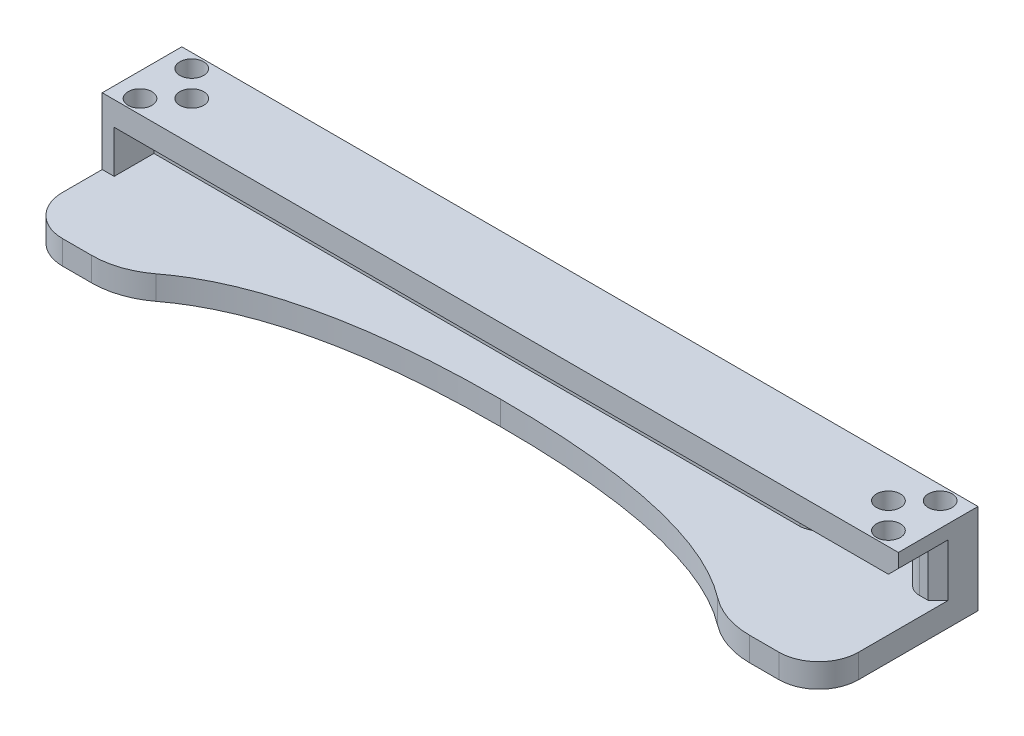
from build123d import *

# Parameters (mm, degrees)
ESBO_O1_W                = 5
ESBO_O1_H                = 5.35
RESSALTO_EXTRUS_O1_DEPTH = 50
CORTE_EXTRUS_O5_START    = -2.675
CORTE_EXTRUS_O5_DEPTH    = 5.35
FILETE2_R                = 2
SKETCH1_W                = 100
SKETCH1_H                = 10
BOSS_EXTRUDE1_DEPTH      = 3
SKETCH2_W                = 100
SKETCH2_H                = 20
BOSS_EXTRUDE2_DEPTH      = 3
FILLET1_R                = 2
FILLET2_R                = 2
CUT_EXTRUDE1_START       = 2.925
CUT_EXTRUDE1_OUTLINE_R   = 1.5
CUT_EXTRUDE1_DEPTH       = 2.75
SKETCH6_W                = 5
SKETCH6_H                = 5.35
BOSS_EXTRUDE4_DEPTH      = 1.5
SKETCH8_R                = 1.5
CUT_EXTRUDE2_DEPTH       = 2.75
CHAMFER2_SIZE            = 1.25
CUT_EXTRUDE3_DEPTH       = 10
FILLET3_R                = 10
FILLET4_R                = 5


# Read off the part's stored shape, not the designer's step: Corte-extrusão5, Cut-Extrude1
with BuildPart() as part:
    # Esboço1 → Ressalto-extrusão1 (new, symmetric)
    with BuildSketch(Plane(origin=(0, 0, 0), x_dir=(0, 0, -1), z_dir=(1, 0, 0))):
        with Locations((-2.5, 0)):
            Rectangle(ESBO_O1_W, ESBO_O1_H)
    extrude(amount=RESSALTO_EXTRUS_O1_DEPTH, both=True)

    # Corte-extrusão5 outline → Corte-extrusão5 (cut)
    with BuildSketch(Plane(origin=(0, 0, 0), x_dir=(1, 0, 0), z_dir=(0, 1, 0)).offset(CORTE_EXTRUS_O5_START)):
        Polygon((46, -5), (45, -0.2), (33, -5), align=None)
    extrude(amount=CORTE_EXTRUS_O5_DEPTH, mode=Mode.SUBTRACT)

    # Filete2
    filete2_edges = [part.edges().sort_by_distance(p)[0] for p in [
        (46, 0, 5),
    ]]
    fillet(filete2_edges, radius=FILETE2_R)

    # Sketch1 → Boss-Extrude1 (add)
    with BuildSketch(Plane(origin=(0, 2.675, 0), x_dir=(1, 0, 0), z_dir=(0, 1, 0))):
        with Locations((0, -5)):
            Rectangle(SKETCH1_W, SKETCH1_H)
    extrude(amount=BOSS_EXTRUDE1_DEPTH)

    # Sketch2 → Boss-Extrude2 (add)
    with BuildSketch(Plane.XZ.offset(2.675)):
        with Locations((0, 10)):
            Rectangle(SKETCH2_W, SKETCH2_H)
    extrude(amount=BOSS_EXTRUDE2_DEPTH)

    # Fillet1
    fillet1_edges = [part.edges().sort_by_distance(p)[0] for p in [
        (45, 0, 0.2),
    ]]
    fillet(fillet1_edges, radius=FILLET1_R)

    # Fillet2
    fillet2_edges = [part.edges().sort_by_distance(p)[0] for p in [
        (33, 0, 5),
    ]]
    fillet(fillet2_edges, radius=FILLET2_R)

    # Cut-Extrude1 outline → Cut-Extrude1 (cut)
    with BuildSketch(Plane(origin=(0, 0, 0), x_dir=(1, 0, 0), z_dir=(0, 1, 0)).offset(CUT_EXTRUDE1_START)):
        with Locations((-43.75, -5)):
            Circle(CUT_EXTRUDE1_OUTLINE_R)
        with Locations((43.75, -5)):
            Circle(CUT_EXTRUDE1_OUTLINE_R)
        with Locations((47, -1.75)):
            Circle(CUT_EXTRUDE1_OUTLINE_R)
        with Locations((47, -8.25)):
            Circle(CUT_EXTRUDE1_OUTLINE_R)
        with Locations((-47, -8.25)):
            Circle(CUT_EXTRUDE1_OUTLINE_R)
        with Locations((-47, -1.75)):
            Circle(CUT_EXTRUDE1_OUTLINE_R)
    extrude(amount=CUT_EXTRUDE1_DEPTH, mode=Mode.SUBTRACT)

    # Sketch6 → Boss-Extrude4 (add)
    with BuildSketch(Plane.ZY.offset(50)):
        with Locations((7.5, 0)):
            Rectangle(SKETCH6_W, SKETCH6_H)
    extrude(amount=-BOSS_EXTRUDE4_DEPTH)

    # Sketch8 → Cut-Extrude2 (cut)
    with BuildSketch(Plane.XZ.offset(5.675)):
        with Locations(Location((47, 8.25, 0), (0, 0, 90))):
            Circle(SKETCH8_R)
        with Locations(Location((43.75, 5, 0), (0, 0, 270))):
            Circle(SKETCH8_R)
        with Locations(Location((47, 1.75, 0), (0, 0, 270))):
            Circle(SKETCH8_R)
        with Locations(Location((-47, 8.25, 0), (0, 0, 270))):
            Circle(SKETCH8_R)
        with Locations(Location((-43.75, 5, 0), (0, 0, 90))):
            Circle(SKETCH8_R)
        with Locations(Location((-47, 1.75, 0), (0, 0, 90))):
            Circle(SKETCH8_R)
    extrude(amount=-CUT_EXTRUDE2_DEPTH, mode=Mode.SUBTRACT)

    # Chamfer2
    chamfer2_edges = [part.edges().sort_by_distance(p)[0] for p in [
        (50, 2.675, 7.5),
        (50, 0, 5),
    ]]
    chamfer(chamfer2_edges, length=CHAMFER2_SIZE)

    # Sketch10 → Cut-Extrude3 (cut)
    with BuildSketch(Plane(origin=(0, -2.675, 0), x_dir=(1, 0, 0), z_dir=(0, 1, 0))):
        with BuildLine():
            Line((-37.586485056, -20), (37.586485056, -20))
            add(Edge.make_bspline(
                [(37.586485056, -20), (27.768328162, -9.955951582), (0, -9.955951582)],
                knots=[0, 0, 0, 1, 1, 1], degree=2))
            add(Edge.make_bspline(
                [(-37.586485056, -20), (-27.768328162, -9.955951582), (0, -9.955951582)],
                knots=[0, 0, 0, 1, 1, 1], degree=2))
        make_face()
    extrude(amount=-CUT_EXTRUDE3_DEPTH, mode=Mode.SUBTRACT)

    # Fillet3
    fillet3_edges = [part.edges().sort_by_distance(p)[0] for p in [
        (37.586485056, -4.175, 20),
        (-37.586485056, -4.175, 20),
    ]]
    fillet(fillet3_edges, radius=FILLET3_R)

    # Fillet4
    fillet4_edges = [part.edges().sort_by_distance(p)[0] for p in [
        (-50, -4.175, 20),
        (50, -4.175, 20),
    ]]
    fillet(fillet4_edges, radius=FILLET4_R)


solid = part.part
